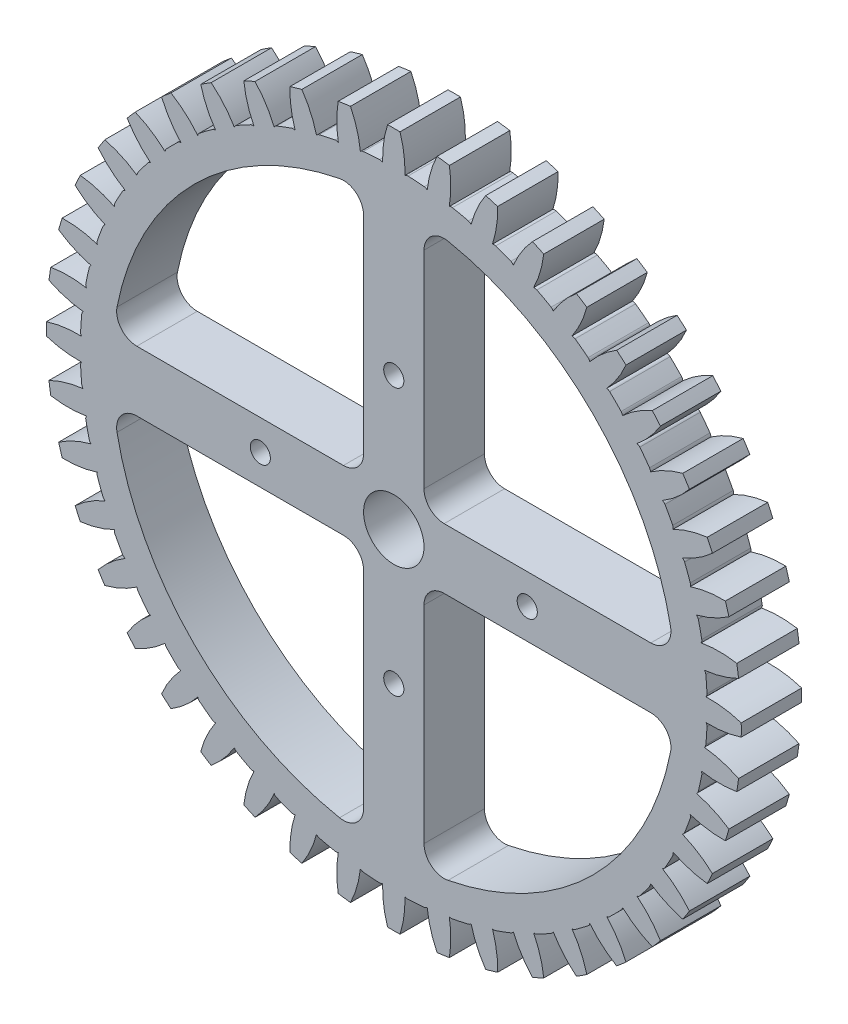
from build123d import *

# Parameters (mm, degrees)
MAINGEAR_DEPTH               = 6
CONG_1_R                     = 0.45
R_P_TITION_CIRCULAIRE1_DEPTH = 6
QUARTSQUAREHOLE_DEPTH        = 50.157908825
SKETCH3_R                    = 3
CENTRALHOLE_DEPTH            = 50.157908825
SKETCH2_R                    = 1
SERVOFIXHOLE_DEPTH           = 50.157908825
CIRPATTERN1_COUNT            = 4
FILLET1_R                    = 2


# Read off the part's stored shape, not the designer's step: Répétition circulaire1
with BuildPart() as part:
    # Esquisse1 → MainGear (new body)
    with BuildSketch(Plane.XY):
        with BuildLine():
            Line((0, 0), (31.045697067, 2.220432077))
            ThreePointArc((31.045697067, 2.220432077), (31.080383808, 1.665943379), (31.105167949, 1.110923891))
            Line((31.105167949, 1.110923891), (30.990097801, 1.10681415))
            ThreePointArc((30.990097801, 1.10681415), (32.763826947, 1.014932949), (34.494503934, 0.615790858))
            ThreePointArc((34.494503934, 0.615790858), (34.5, 0), (34.494503934, -0.615790858))
            ThreePointArc((34.494503934, -0.615790858), (32.763826947, -1.014932949), (30.990097801, -1.10681415))
            Line((30.990097801, -1.10681415), (31.105167949, -1.110923891))
            ThreePointArc((31.105167949, -1.110923891), (31.080383808, -1.665943379), (31.045697067, -2.220432077))
            Line((31.045697067, -2.220432077), (0, 0))
        make_face()
    extrude(amount=MAINGEAR_DEPTH)

    # Congé1
    # the kernel refuses this fillet: 0.45 mm, written as the material it takes off along each edge
    with BuildSketch(Plane(origin=(31.105167949, -1.110923891, -0.758441469), x_dir=(-0.999362825656991, 0.035692333839000355, 0), z_dir=(0, 0, 1))) as cong_1_piece_1:
        with BuildLine():
            CenterArc((0.451457136, 0.298986869), CONG_1_R, 179.441533594, 42.19594814)
            ThreePointArc((0.001478512, 0.303372985), (0.00036963, 0.151688294), (0, 0))
            Line((0, 0), (0.115143514, 0))
        make_face()
    extrude(amount=7.516882937, mode=Mode.SUBTRACT)
    with BuildSketch(Plane(origin=(31.105167949, 1.110923891, -0.758441469), x_dir=(-0.04056232416390557, 0.9991770102731659, 0), z_dir=(0, 0, 1))) as cong_1_piece_2:
        with BuildLine():
            CenterArc((0.301183504, 0.449994656), CONG_1_R, 228.083285063, 42.19594814)
            Line((0.000561154, 0.115142147), (0, 0))
            ThreePointArc((0, 0), (0.151688294, -0.00036963), (0.303376587, 0))
        make_face()
    extrude(amount=7.516882937, mode=Mode.SUBTRACT)

    # Répétition circulaire1 outline → Répétition circulaire1 (add)
    with BuildSketch(Plane.XY):
        with BuildLine():
            ThreePointArc((30.977622194, -3.025317864), (31.014270801, -2.623095816), (31.045697067, -2.220432077))
            Line((31.045697067, -2.220432077), (0, 0))
            Line((0, 0), (31.045697067, 2.220432077))
            ThreePointArc((31.045697067, 2.220432077), (31.014270801, 2.623095816), (30.977622194, 3.025317864))
            ThreePointArc((30.977622194, 3.025317864), (30.931855196, 3.183602561), (30.832179366, 3.314802379))
            ThreePointArc((30.832179366, 3.314802379), (32.574778449, 3.658176338), (34.231035797, 4.299556754))
            ThreePointArc((34.231035797, 4.299556754), (34.148839745, 4.909861921), (34.055763444, 5.518602744))
            ThreePointArc((34.055763444, 5.518602744), (32.285898412, 5.667381129), (30.517147213, 5.505899134))
            ThreePointArc((30.517147213, 5.505899134), (30.575822211, 5.659866364), (30.575141372, 5.824633472))
            ThreePointArc((30.575141372, 5.824633472), (30.413696203, 6.616094637), (30.231767044, 7.403099783))
            ThreePointArc((30.231767044, 7.403099783), (30.163939626, 7.553260046), (30.046606672, 7.66893909))
            ThreePointArc((30.046606672, 7.66893909), (31.722601399, 8.256815704), (33.270722485, 9.127377789))
            ThreePointArc((33.270722485, 9.127377789), (33.10250759, 9.719773211), (32.92374582, 10.309071792))
            ThreePointArc((32.92374582, 10.309071792), (31.15072209, 10.204457771), (29.422955511, 9.79289989))
            ThreePointArc((29.422955511, 9.79289989), (29.459121461, 9.953650278), (29.434998748, 10.116643401))
            ThreePointArc((29.434998748, 10.116643401), (29.162560191, 10.87707259), (28.870480298, 11.630175939))
            ThreePointArc((28.870480298, 11.630175939), (28.781973232, 11.76915494), (28.649371713, 11.866958317))
            ThreePointArc((28.649371713, 11.866958317), (30.224643666, 12.687370113), (31.633113209, 13.769391733))
            ThreePointArc((31.633113209, 13.769391733), (31.38230384, 14.331817949), (31.121495674, 14.889677867))
            ThreePointArc((31.121495674, 14.889677867), (29.381406897, 14.533801081), (27.729797284, 13.880545445))
            ThreePointArc((27.729797284, 13.880545445), (27.742717951, 14.044806577), (27.695644433, 14.202707645))
            ThreePointArc((27.695644433, 14.202707645), (27.31775855, 14.916624712), (26.921473828, 15.620495252))
            ThreePointArc((26.921473828, 15.620495252), (26.814088863, 15.745463778), (26.668918165, 15.823400494))
            ThreePointArc((26.668918165, 15.823400494), (28.111399348, 16.859646255), (29.35154497, 18.13110057))
            ThreePointArc((29.35154497, 18.13110057), (29.023246883, 18.652108203), (28.685701624, 19.167173039))
            ThreePointArc((28.685701624, 19.167173039), (27.013970989, 18.567278113), (25.472140351, 17.685623122))
            ThreePointArc((25.472140351, 17.685623122), (25.461552708, 17.850051116), (25.392486665, 17.999645718))
            ThreePointArc((25.392486665, 17.999645718), (24.916846124, 18.65251737), (24.424423787, 19.292826327))
            ThreePointArc((24.424423787, 19.292826327), (24.30034697, 19.40124038), (24.145562349, 19.457723868))
            ThreePointArc((24.145562349, 19.457723868), (25.425888006, 20.688708617), (26.472463919, 22.123712484))
            ThreePointArc((26.472463919, 22.123712484), (26.073360315, 22.592695321), (25.665949412, 23.054479842))
            ThreePointArc((25.665949412, 23.054479842), (24.096608534, 22.222778906), (22.695944096, 21.130672514))
            ThreePointArc((22.695944096, 21.130672514), (22.662063676, 21.291920089), (22.572411094, 21.430162911))
            ThreePointArc((22.572411094, 21.430162911), (22.008698564, 22.008698564), (21.430162911, 22.572411094))
            ThreePointArc((21.430162911, 22.572411094), (21.291920089, 22.662063676), (21.130672514, 22.695944096))
            ThreePointArc((21.130672514, 22.695944096), (22.222778906, 24.096608534), (23.054479842, 25.665949412))
            ThreePointArc((23.054479842, 25.665949412), (22.592695321, 26.073360315), (22.123712484, 26.472463919))
            ThreePointArc((22.123712484, 26.472463919), (20.688708617, 25.425888006), (19.457723868, 24.145562349))
            ThreePointArc((19.457723868, 24.145562349), (19.40124038, 24.30034697), (19.292826327, 24.424423787))
            ThreePointArc((19.292826327, 24.424423787), (18.65251737, 24.916846124), (17.999645718, 25.392486665))
            ThreePointArc((17.999645718, 25.392486665), (17.850051116, 25.461552708), (17.685623122, 25.472140351))
            ThreePointArc((17.685623122, 25.472140351), (18.567278113, 27.013970989), (19.167173039, 28.685701624))
            ThreePointArc((19.167173039, 28.685701624), (18.652108203, 29.023246883), (18.13110057, 29.35154497))
            ThreePointArc((18.13110057, 29.35154497), (16.859646255, 28.111399348), (15.823400494, 26.668918165))
            ThreePointArc((15.823400494, 26.668918165), (15.745463778, 26.814088863), (15.620495252, 26.921473828))
            ThreePointArc((15.620495252, 26.921473828), (14.916624712, 27.31775855), (14.202707645, 27.695644433))
            ThreePointArc((14.202707645, 27.695644433), (14.044806577, 27.742717951), (13.880545445, 27.729797284))
            ThreePointArc((13.880545445, 27.729797284), (14.533801081, 29.381406897), (14.889677867, 31.121495674))
            ThreePointArc((14.889677867, 31.121495674), (14.331817949, 31.38230384), (13.769391733, 31.633113209))
            ThreePointArc((13.769391733, 31.633113209), (12.687370113, 30.224643666), (11.866958317, 28.649371713))
            ThreePointArc((11.866958317, 28.649371713), (11.76915494, 28.781973232), (11.630175939, 28.870480298))
            ThreePointArc((11.630175939, 28.870480298), (10.87707259, 29.162560191), (10.116643401, 29.434998748))
            ThreePointArc((10.116643401, 29.434998748), (9.953650278, 29.459121461), (9.79289989, 29.422955511))
            ThreePointArc((9.79289989, 29.422955511), (10.204457771, 31.15072209), (10.309071792, 32.92374582))
            ThreePointArc((10.309071792, 32.92374582), (9.719773211, 33.10250759), (9.127377789, 33.270722485))
            ThreePointArc((9.127377789, 33.270722485), (8.256815704, 31.722601399), (7.66893909, 30.046606672))
            ThreePointArc((7.66893909, 30.046606672), (7.553260046, 30.163939626), (7.403099783, 30.231767044))
            ThreePointArc((7.403099783, 30.231767044), (6.616094637, 30.413696203), (5.824633472, 30.575141372))
            ThreePointArc((5.824633472, 30.575141372), (5.659866364, 30.575822211), (5.505899134, 30.517147213))
            ThreePointArc((5.505899134, 30.517147213), (5.667381129, 32.285898412), (5.518602744, 34.055763444))
            ThreePointArc((5.518602744, 34.055763444), (4.909861921, 34.148839745), (4.299556754, 34.231035797))
            ThreePointArc((4.299556754, 34.231035797), (3.658176338, 32.574778449), (3.314802379, 30.832179366))
            ThreePointArc((3.314802379, 30.832179366), (3.183602561, 30.931855196), (3.025317864, 30.977622194))
            ThreePointArc((3.025317864, 30.977622194), (2.220432077, 31.045697067), (1.414050802, 31.092862289))
            ThreePointArc((1.414050802, 31.092862289), (1.250863893, 31.070087393), (1.10681415, 30.990097801))
            ThreePointArc((1.10681415, 30.990097801), (1.014932949, 32.763826948), (0.615790858, 34.494503934))
            ThreePointArc((0.615790858, 34.494503934), (0, 34.5), (-0.615790858, 34.494503934))
            ThreePointArc((-0.615790858, 34.494503934), (-1.014932949, 32.763826948), (-1.10681415, 30.990097801))
            ThreePointArc((-1.10681415, 30.990097801), (-1.250863893, 31.070087393), (-1.414050802, 31.092862289))
            ThreePointArc((-1.414050802, 31.092862289), (-2.220432077, 31.045697067), (-3.025317864, 30.977622194))
            ThreePointArc((-3.025317864, 30.977622194), (-3.183602561, 30.931855196), (-3.314802379, 30.832179366))
            ThreePointArc((-3.314802379, 30.832179366), (-3.658176338, 32.574778449), (-4.299556754, 34.231035797))
            ThreePointArc((-4.299556754, 34.231035797), (-4.909861921, 34.148839745), (-5.518602744, 34.055763444))
            ThreePointArc((-5.518602744, 34.055763444), (-5.667381129, 32.285898412), (-5.505899134, 30.517147213))
            ThreePointArc((-5.505899134, 30.517147213), (-5.659866364, 30.575822211), (-5.824633472, 30.575141372))
            ThreePointArc((-5.824633472, 30.575141372), (-6.616094637, 30.413696203), (-7.403099783, 30.231767044))
            ThreePointArc((-7.403099783, 30.231767044), (-7.553260046, 30.163939626), (-7.66893909, 30.046606672))
            ThreePointArc((-7.66893909, 30.046606672), (-8.256815704, 31.722601399), (-9.127377789, 33.270722485))
            ThreePointArc((-9.127377789, 33.270722485), (-9.719773211, 33.10250759), (-10.309071792, 32.92374582))
            ThreePointArc((-10.309071792, 32.92374582), (-10.204457771, 31.15072209), (-9.79289989, 29.422955511))
            ThreePointArc((-9.79289989, 29.422955511), (-9.953650278, 29.459121461), (-10.116643401, 29.434998748))
            ThreePointArc((-10.116643401, 29.434998748), (-10.87707259, 29.162560191), (-11.630175939, 28.870480298))
            ThreePointArc((-11.630175939, 28.870480298), (-11.76915494, 28.781973232), (-11.866958317, 28.649371713))
            ThreePointArc((-11.866958317, 28.649371713), (-12.687370113, 30.224643666), (-13.769391733, 31.633113209))
            ThreePointArc((-13.769391733, 31.633113209), (-14.331817949, 31.38230384), (-14.889677867, 31.121495674))
            ThreePointArc((-14.889677867, 31.121495674), (-14.533801081, 29.381406897), (-13.880545445, 27.729797284))
            ThreePointArc((-13.880545445, 27.729797284), (-14.044806577, 27.742717951), (-14.202707645, 27.695644433))
            ThreePointArc((-14.202707645, 27.695644433), (-14.916624712, 27.31775855), (-15.620495252, 26.921473828))
            ThreePointArc((-15.620495252, 26.921473828), (-15.745463778, 26.814088863), (-15.823400494, 26.668918165))
            ThreePointArc((-15.823400494, 26.668918165), (-16.859646255, 28.111399348), (-18.13110057, 29.35154497))
            ThreePointArc((-18.13110057, 29.35154497), (-18.652108203, 29.023246883), (-19.167173039, 28.685701624))
            ThreePointArc((-19.167173039, 28.685701624), (-18.567278113, 27.013970989), (-17.685623122, 25.472140351))
            ThreePointArc((-17.685623122, 25.472140351), (-17.850051116, 25.461552708), (-17.999645718, 25.392486665))
            ThreePointArc((-17.999645718, 25.392486665), (-18.65251737, 24.916846124), (-19.292826327, 24.424423787))
            ThreePointArc((-19.292826327, 24.424423787), (-19.40124038, 24.30034697), (-19.457723868, 24.145562349))
            ThreePointArc((-19.457723868, 24.145562349), (-20.688708617, 25.425888006), (-22.123712484, 26.472463919))
            ThreePointArc((-22.123712484, 26.472463919), (-22.592695321, 26.073360315), (-23.054479842, 25.665949412))
            ThreePointArc((-23.054479842, 25.665949412), (-22.222778906, 24.096608534), (-21.130672514, 22.695944096))
            ThreePointArc((-21.130672514, 22.695944096), (-21.291920089, 22.662063676), (-21.430162911, 22.572411094))
            ThreePointArc((-21.430162911, 22.572411094), (-22.008698564, 22.008698564), (-22.572411094, 21.430162911))
            ThreePointArc((-22.572411094, 21.430162911), (-22.662063676, 21.291920089), (-22.695944096, 21.130672514))
            ThreePointArc((-22.695944096, 21.130672514), (-24.096608534, 22.222778906), (-25.665949412, 23.054479842))
            ThreePointArc((-25.665949412, 23.054479842), (-26.073360315, 22.592695321), (-26.472463919, 22.123712484))
            ThreePointArc((-26.472463919, 22.123712484), (-25.425888006, 20.688708617), (-24.145562349, 19.457723868))
            ThreePointArc((-24.145562349, 19.457723868), (-24.30034697, 19.40124038), (-24.424423787, 19.292826327))
            ThreePointArc((-24.424423787, 19.292826327), (-24.916846124, 18.65251737), (-25.392486665, 17.999645718))
            ThreePointArc((-25.392486665, 17.999645718), (-25.461552708, 17.850051116), (-25.472140351, 17.685623122))
            ThreePointArc((-25.472140351, 17.685623122), (-27.013970989, 18.567278113), (-28.685701624, 19.167173039))
            ThreePointArc((-28.685701624, 19.167173039), (-29.023246883, 18.652108203), (-29.35154497, 18.13110057))
            ThreePointArc((-29.35154497, 18.13110057), (-28.111399348, 16.859646255), (-26.668918165, 15.823400494))
            ThreePointArc((-26.668918165, 15.823400494), (-26.814088863, 15.745463778), (-26.921473828, 15.620495252))
            ThreePointArc((-26.921473828, 15.620495252), (-27.31775855, 14.916624712), (-27.695644433, 14.202707645))
            ThreePointArc((-27.695644433, 14.202707645), (-27.742717951, 14.044806577), (-27.729797284, 13.880545445))
            ThreePointArc((-27.729797284, 13.880545445), (-29.381406897, 14.533801081), (-31.121495674, 14.889677867))
            ThreePointArc((-31.121495674, 14.889677867), (-31.38230384, 14.331817949), (-31.633113209, 13.769391733))
            ThreePointArc((-31.633113209, 13.769391733), (-30.224643666, 12.687370113), (-28.649371713, 11.866958317))
            ThreePointArc((-28.649371713, 11.866958317), (-28.781973232, 11.76915494), (-28.870480298, 11.630175939))
            ThreePointArc((-28.870480298, 11.630175939), (-29.162560191, 10.87707259), (-29.434998748, 10.116643401))
            ThreePointArc((-29.434998748, 10.116643401), (-29.459121461, 9.953650278), (-29.422955511, 9.79289989))
            ThreePointArc((-29.422955511, 9.79289989), (-31.15072209, 10.204457771), (-32.92374582, 10.309071792))
            ThreePointArc((-32.92374582, 10.309071792), (-33.10250759, 9.719773211), (-33.270722485, 9.127377789))
            ThreePointArc((-33.270722485, 9.127377789), (-31.722601399, 8.256815704), (-30.046606672, 7.66893909))
            ThreePointArc((-30.046606672, 7.66893909), (-30.163939626, 7.553260046), (-30.231767044, 7.403099783))
            ThreePointArc((-30.231767044, 7.403099783), (-30.413696203, 6.616094637), (-30.575141372, 5.824633472))
            ThreePointArc((-30.575141372, 5.824633472), (-30.575822211, 5.659866364), (-30.517147213, 5.505899134))
            ThreePointArc((-30.517147213, 5.505899134), (-32.285898412, 5.667381129), (-34.055763444, 5.518602744))
            ThreePointArc((-34.055763444, 5.518602744), (-34.148839745, 4.909861921), (-34.231035797, 4.299556754))
            ThreePointArc((-34.231035797, 4.299556754), (-32.574778449, 3.658176338), (-30.832179366, 3.314802379))
            ThreePointArc((-30.832179366, 3.314802379), (-30.931855196, 3.183602561), (-30.977622194, 3.025317864))
            ThreePointArc((-30.977622194, 3.025317864), (-31.045697067, 2.220432077), (-31.092862289, 1.414050802))
            ThreePointArc((-31.092862289, 1.414050802), (-31.070087393, 1.250863893), (-30.990097801, 1.10681415))
            ThreePointArc((-30.990097801, 1.10681415), (-32.763826948, 1.014932949), (-34.494503934, 0.615790858))
            ThreePointArc((-34.494503934, 0.615790858), (-34.5, 0), (-34.494503934, -0.615790858))
            ThreePointArc((-34.494503934, -0.615790858), (-32.763826948, -1.014932949), (-30.990097801, -1.10681415))
            ThreePointArc((-30.990097801, -1.10681415), (-31.070087393, -1.250863893), (-31.092862289, -1.414050802))
            ThreePointArc((-31.092862289, -1.414050802), (-31.045697067, -2.220432077), (-30.977622194, -3.025317864))
            ThreePointArc((-30.977622194, -3.025317864), (-30.931855196, -3.183602561), (-30.832179366, -3.314802379))
            ThreePointArc((-30.832179366, -3.314802379), (-32.574778449, -3.658176338), (-34.231035797, -4.299556754))
            ThreePointArc((-34.231035797, -4.299556754), (-34.148839745, -4.909861921), (-34.055763444, -5.518602744))
            ThreePointArc((-34.055763444, -5.518602744), (-32.285898412, -5.667381129), (-30.517147213, -5.505899134))
            ThreePointArc((-30.517147213, -5.505899134), (-30.575822211, -5.659866364), (-30.575141372, -5.824633472))
            ThreePointArc((-30.575141372, -5.824633472), (-30.413696203, -6.616094637), (-30.231767044, -7.403099783))
            ThreePointArc((-30.231767044, -7.403099783), (-30.163939626, -7.553260046), (-30.046606672, -7.66893909))
            ThreePointArc((-30.046606672, -7.66893909), (-31.722601399, -8.256815704), (-33.270722485, -9.127377789))
            ThreePointArc((-33.270722485, -9.127377789), (-33.10250759, -9.719773211), (-32.92374582, -10.309071792))
            ThreePointArc((-32.92374582, -10.309071792), (-31.15072209, -10.204457771), (-29.422955511, -9.79289989))
            ThreePointArc((-29.422955511, -9.79289989), (-29.459121461, -9.953650278), (-29.434998748, -10.116643401))
            ThreePointArc((-29.434998748, -10.116643401), (-29.162560191, -10.87707259), (-28.870480298, -11.630175939))
            ThreePointArc((-28.870480298, -11.630175939), (-28.781973232, -11.76915494), (-28.649371713, -11.866958317))
            ThreePointArc((-28.649371713, -11.866958317), (-30.224643666, -12.687370113), (-31.633113209, -13.769391733))
            ThreePointArc((-31.633113209, -13.769391733), (-31.38230384, -14.331817949), (-31.121495674, -14.889677867))
            ThreePointArc((-31.121495674, -14.889677867), (-29.381406897, -14.533801081), (-27.729797284, -13.880545445))
            ThreePointArc((-27.729797284, -13.880545445), (-27.742717951, -14.044806577), (-27.695644433, -14.202707645))
            ThreePointArc((-27.695644433, -14.202707645), (-27.31775855, -14.916624712), (-26.921473828, -15.620495252))
            ThreePointArc((-26.921473828, -15.620495252), (-26.814088863, -15.745463778), (-26.668918165, -15.823400494))
            ThreePointArc((-26.668918165, -15.823400494), (-28.111399348, -16.859646255), (-29.35154497, -18.13110057))
            ThreePointArc((-29.35154497, -18.13110057), (-29.023246883, -18.652108203), (-28.685701624, -19.167173039))
            ThreePointArc((-28.685701624, -19.167173039), (-27.013970989, -18.567278113), (-25.472140351, -17.685623122))
            ThreePointArc((-25.472140351, -17.685623122), (-25.461552708, -17.850051116), (-25.392486665, -17.999645718))
            ThreePointArc((-25.392486665, -17.999645718), (-24.916846124, -18.65251737), (-24.424423787, -19.292826327))
            ThreePointArc((-24.424423787, -19.292826327), (-24.30034697, -19.40124038), (-24.145562349, -19.457723868))
            ThreePointArc((-24.145562349, -19.457723868), (-25.425888006, -20.688708617), (-26.472463919, -22.123712484))
            ThreePointArc((-26.472463919, -22.123712484), (-26.073360315, -22.592695321), (-25.665949412, -23.054479842))
            ThreePointArc((-25.665949412, -23.054479842), (-24.096608534, -22.222778906), (-22.695944096, -21.130672514))
            ThreePointArc((-22.695944096, -21.130672514), (-22.662063676, -21.291920089), (-22.572411094, -21.430162911))
            ThreePointArc((-22.572411094, -21.430162911), (-22.008698564, -22.008698564), (-21.430162911, -22.572411094))
            ThreePointArc((-21.430162911, -22.572411094), (-21.291920089, -22.662063676), (-21.130672514, -22.695944096))
            ThreePointArc((-21.130672514, -22.695944096), (-22.222778906, -24.096608534), (-23.054479842, -25.665949412))
            ThreePointArc((-23.054479842, -25.665949412), (-22.592695321, -26.073360315), (-22.123712484, -26.472463919))
            ThreePointArc((-22.123712484, -26.472463919), (-20.688708617, -25.425888006), (-19.457723868, -24.145562349))
            ThreePointArc((-19.457723868, -24.145562349), (-19.40124038, -24.30034697), (-19.292826327, -24.424423787))
            ThreePointArc((-19.292826327, -24.424423787), (-18.65251737, -24.916846124), (-17.999645718, -25.392486665))
            ThreePointArc((-17.999645718, -25.392486665), (-17.850051116, -25.461552708), (-17.685623122, -25.472140351))
            ThreePointArc((-17.685623122, -25.472140351), (-18.567278113, -27.013970989), (-19.167173039, -28.685701624))
            ThreePointArc((-19.167173039, -28.685701624), (-18.652108203, -29.023246883), (-18.13110057, -29.35154497))
            ThreePointArc((-18.13110057, -29.35154497), (-16.859646255, -28.111399348), (-15.823400494, -26.668918165))
            ThreePointArc((-15.823400494, -26.668918165), (-15.745463778, -26.814088863), (-15.620495252, -26.921473828))
            ThreePointArc((-15.620495252, -26.921473828), (-14.916624712, -27.31775855), (-14.202707645, -27.695644433))
            ThreePointArc((-14.202707645, -27.695644433), (-14.044806577, -27.742717951), (-13.880545445, -27.729797284))
            ThreePointArc((-13.880545445, -27.729797284), (-14.533801081, -29.381406897), (-14.889677867, -31.121495674))
            ThreePointArc((-14.889677867, -31.121495674), (-14.331817949, -31.38230384), (-13.769391733, -31.633113209))
            ThreePointArc((-13.769391733, -31.633113209), (-12.687370113, -30.224643666), (-11.866958317, -28.649371713))
            ThreePointArc((-11.866958317, -28.649371713), (-11.76915494, -28.781973232), (-11.630175939, -28.870480298))
            ThreePointArc((-11.630175939, -28.870480298), (-10.87707259, -29.162560191), (-10.116643401, -29.434998748))
            ThreePointArc((-10.116643401, -29.434998748), (-9.953650278, -29.459121461), (-9.79289989, -29.422955511))
            ThreePointArc((-9.79289989, -29.422955511), (-10.204457771, -31.15072209), (-10.309071792, -32.92374582))
            ThreePointArc((-10.309071792, -32.92374582), (-9.719773211, -33.10250759), (-9.127377789, -33.270722485))
            ThreePointArc((-9.127377789, -33.270722485), (-8.256815704, -31.722601399), (-7.66893909, -30.046606672))
            ThreePointArc((-7.66893909, -30.046606672), (-7.553260046, -30.163939626), (-7.403099783, -30.231767044))
            ThreePointArc((-7.403099783, -30.231767044), (-6.616094637, -30.413696203), (-5.824633472, -30.575141372))
            ThreePointArc((-5.824633472, -30.575141372), (-5.659866364, -30.575822211), (-5.505899134, -30.517147213))
            ThreePointArc((-5.505899134, -30.517147213), (-5.667381129, -32.285898412), (-5.518602744, -34.055763444))
            ThreePointArc((-5.518602744, -34.055763444), (-4.909861921, -34.148839745), (-4.299556754, -34.231035797))
            ThreePointArc((-4.299556754, -34.231035797), (-3.658176338, -32.574778449), (-3.314802379, -30.832179366))
            ThreePointArc((-3.314802379, -30.832179366), (-3.183602561, -30.931855196), (-3.025317864, -30.977622194))
            ThreePointArc((-3.025317864, -30.977622194), (-2.220432077, -31.045697067), (-1.414050802, -31.092862289))
            ThreePointArc((-1.414050802, -31.092862289), (-1.250863893, -31.070087393), (-1.10681415, -30.990097801))
            ThreePointArc((-1.10681415, -30.990097801), (-1.014932949, -32.763826948), (-0.615790858, -34.494503934))
            ThreePointArc((-0.615790858, -34.494503934), (0, -34.5), (0.615790858, -34.494503934))
            ThreePointArc((0.615790858, -34.494503934), (1.014932949, -32.763826948), (1.10681415, -30.990097801))
            ThreePointArc((1.10681415, -30.990097801), (1.250863893, -31.070087393), (1.414050802, -31.092862289))
            ThreePointArc((1.414050802, -31.092862289), (2.220432077, -31.045697067), (3.025317864, -30.977622194))
            ThreePointArc((3.025317864, -30.977622194), (3.183602561, -30.931855196), (3.314802379, -30.832179366))
            ThreePointArc((3.314802379, -30.832179366), (3.658176338, -32.574778449), (4.299556754, -34.231035797))
            ThreePointArc((4.299556754, -34.231035797), (4.909861921, -34.148839745), (5.518602744, -34.055763444))
            ThreePointArc((5.518602744, -34.055763444), (5.667381129, -32.285898412), (5.505899134, -30.517147213))
            ThreePointArc((5.505899134, -30.517147213), (5.659866364, -30.575822211), (5.824633472, -30.575141372))
            ThreePointArc((5.824633472, -30.575141372), (6.616094637, -30.413696203), (7.403099783, -30.231767044))
            ThreePointArc((7.403099783, -30.231767044), (7.553260046, -30.163939626), (7.66893909, -30.046606672))
            ThreePointArc((7.66893909, -30.046606672), (8.256815704, -31.722601399), (9.127377789, -33.270722485))
            ThreePointArc((9.127377789, -33.270722485), (9.719773211, -33.10250759), (10.309071792, -32.92374582))
            ThreePointArc((10.309071792, -32.92374582), (10.204457771, -31.15072209), (9.79289989, -29.422955511))
            ThreePointArc((9.79289989, -29.422955511), (9.953650278, -29.459121461), (10.116643401, -29.434998748))
            ThreePointArc((10.116643401, -29.434998748), (10.87707259, -29.162560191), (11.630175939, -28.870480298))
            ThreePointArc((11.630175939, -28.870480298), (11.76915494, -28.781973232), (11.866958317, -28.649371713))
            ThreePointArc((11.866958317, -28.649371713), (12.687370113, -30.224643666), (13.769391733, -31.633113209))
            ThreePointArc((13.769391733, -31.633113209), (14.331817949, -31.38230384), (14.889677867, -31.121495674))
            ThreePointArc((14.889677867, -31.121495674), (14.533801081, -29.381406897), (13.880545445, -27.729797284))
            ThreePointArc((13.880545445, -27.729797284), (14.044806577, -27.742717951), (14.202707645, -27.695644433))
            ThreePointArc((14.202707645, -27.695644433), (14.916624712, -27.31775855), (15.620495252, -26.921473828))
            ThreePointArc((15.620495252, -26.921473828), (15.745463778, -26.814088863), (15.823400494, -26.668918165))
            ThreePointArc((15.823400494, -26.668918165), (16.859646255, -28.111399348), (18.13110057, -29.35154497))
            ThreePointArc((18.13110057, -29.35154497), (18.652108203, -29.023246883), (19.167173039, -28.685701624))
            ThreePointArc((19.167173039, -28.685701624), (18.567278113, -27.013970989), (17.685623122, -25.472140351))
            ThreePointArc((17.685623122, -25.472140351), (17.850051116, -25.461552708), (17.999645718, -25.392486665))
            ThreePointArc((17.999645718, -25.392486665), (18.65251737, -24.916846124), (19.292826327, -24.424423787))
            ThreePointArc((19.292826327, -24.424423787), (19.40124038, -24.30034697), (19.457723868, -24.145562349))
            ThreePointArc((19.457723868, -24.145562349), (20.688708617, -25.425888006), (22.123712484, -26.472463919))
            ThreePointArc((22.123712484, -26.472463919), (22.592695321, -26.073360315), (23.054479842, -25.665949412))
            ThreePointArc((23.054479842, -25.665949412), (22.222778906, -24.096608534), (21.130672514, -22.695944096))
            ThreePointArc((21.130672514, -22.695944096), (21.291920089, -22.662063676), (21.430162911, -22.572411094))
            ThreePointArc((21.430162911, -22.572411094), (22.008698564, -22.008698564), (22.572411094, -21.430162911))
            ThreePointArc((22.572411094, -21.430162911), (22.662063676, -21.291920089), (22.695944096, -21.130672514))
            ThreePointArc((22.695944096, -21.130672514), (24.096608534, -22.222778906), (25.665949412, -23.054479842))
            ThreePointArc((25.665949412, -23.054479842), (26.073360315, -22.592695321), (26.472463919, -22.123712484))
            ThreePointArc((26.472463919, -22.123712484), (25.425888006, -20.688708617), (24.145562349, -19.457723868))
            ThreePointArc((24.145562349, -19.457723868), (24.30034697, -19.40124038), (24.424423787, -19.292826327))
            ThreePointArc((24.424423787, -19.292826327), (24.916846124, -18.65251737), (25.392486665, -17.999645718))
            ThreePointArc((25.392486665, -17.999645718), (25.461552708, -17.850051116), (25.472140351, -17.685623122))
            ThreePointArc((25.472140351, -17.685623122), (27.013970989, -18.567278113), (28.685701624, -19.167173039))
            ThreePointArc((28.685701624, -19.167173039), (29.023246883, -18.652108203), (29.35154497, -18.13110057))
            ThreePointArc((29.35154497, -18.13110057), (28.111399348, -16.859646255), (26.668918165, -15.823400494))
            ThreePointArc((26.668918165, -15.823400494), (26.814088863, -15.745463778), (26.921473828, -15.620495252))
            ThreePointArc((26.921473828, -15.620495252), (27.31775855, -14.916624712), (27.695644433, -14.202707645))
            ThreePointArc((27.695644433, -14.202707645), (27.742717951, -14.044806577), (27.729797284, -13.880545445))
            ThreePointArc((27.729797284, -13.880545445), (29.381406897, -14.533801081), (31.121495674, -14.889677867))
            ThreePointArc((31.121495674, -14.889677867), (31.38230384, -14.331817949), (31.633113209, -13.769391733))
            ThreePointArc((31.633113209, -13.769391733), (30.224643666, -12.687370113), (28.649371713, -11.866958317))
            ThreePointArc((28.649371713, -11.866958317), (28.781973232, -11.76915494), (28.870480298, -11.630175939))
            ThreePointArc((28.870480298, -11.630175939), (29.162560191, -10.87707259), (29.434998748, -10.116643401))
            ThreePointArc((29.434998748, -10.116643401), (29.459121461, -9.953650278), (29.422955511, -9.79289989))
            ThreePointArc((29.422955511, -9.79289989), (31.15072209, -10.204457771), (32.92374582, -10.309071792))
            ThreePointArc((32.92374582, -10.309071792), (33.10250759, -9.719773211), (33.270722485, -9.127377789))
            ThreePointArc((33.270722485, -9.127377789), (31.722601399, -8.256815704), (30.046606672, -7.66893909))
            ThreePointArc((30.046606672, -7.66893909), (30.163939626, -7.553260046), (30.231767044, -7.403099783))
            ThreePointArc((30.231767044, -7.403099783), (30.413696203, -6.616094637), (30.575141372, -5.824633472))
            ThreePointArc((30.575141372, -5.824633472), (30.575822211, -5.659866364), (30.517147213, -5.505899134))
            ThreePointArc((30.517147213, -5.505899134), (32.285898412, -5.667381129), (34.055763444, -5.518602744))
            ThreePointArc((34.055763444, -5.518602744), (34.148839745, -4.909861921), (34.231035797, -4.299556754))
            ThreePointArc((34.231035797, -4.299556754), (32.574778449, -3.658176338), (30.832179366, -3.314802379))
            ThreePointArc((30.832179366, -3.314802379), (30.931855196, -3.183602561), (30.977622194, -3.025317864))
        make_face()
    extrude(amount=R_P_TITION_CIRCULAIRE1_DEPTH)

    # Sketch1 → QuartSquareHole (cut, through all)
    with BuildSketch(Plane.XY.offset(6)):
        with BuildLine():
            Line((3, 27.838821814), (3, 3))
            Line((3, 3), (27.838821814, 3))
            ThreePointArc((27.838821814, 3), (19.798989873, 19.798989873), (3, 27.838821814))
        make_face()
    quartsquarehole = extrude(amount=-QUARTSQUAREHOLE_DEPTH, mode=Mode.SUBTRACT)

    # Sketch3 → CentralHole (cut, through all)
    with BuildSketch(Plane.XY.offset(6)):
        Circle(SKETCH3_R)
    extrude(amount=-CENTRALHOLE_DEPTH, mode=Mode.SUBTRACT)

    # Sketch2 → ServoFixHole (cut, symmetric)
    with BuildSketch(Plane.XY.offset(6)):
        with Locations((13.25, 0)):
            Circle(SKETCH2_R)
    servofixhole = extrude(amount=SERVOFIXHOLE_DEPTH, both=True, mode=Mode.SUBTRACT)

    # CirPattern1: QuartSquareHole, ServoFixHole ×4 about axis
    cirpattern1_axis = Axis((0, 0, 0), (0, 0, 1))
    add([quartsquarehole.rotate(cirpattern1_axis, i * 360 / CIRPATTERN1_COUNT) for i in range(1, CIRPATTERN1_COUNT)], mode=Mode.SUBTRACT)
    add([servofixhole.rotate(cirpattern1_axis, i * 360 / CIRPATTERN1_COUNT) for i in range(1, CIRPATTERN1_COUNT)], mode=Mode.SUBTRACT)

    # Fillet1
    fillet1_edges = [part.edges().sort_by_distance(p)[0] for p in [
        (3, 27.838821814, 3),
        (27.838821814, 3, 3),
        (3, 3, 3),
        (27.838821814, -3, 3),
        (3, -27.838821814, 3),
        (3, -3, 3),
        (-3, -27.838821814, 3),
        (-27.838821814, -3, 3),
        (-3, -3, 3),
        (-27.838821814, 3, 3),
        (-3, 27.838821814, 3),
        (-3, 3, 3),
    ]]
    fillet(fillet1_edges, radius=FILLET1_R)


solid = part.part
